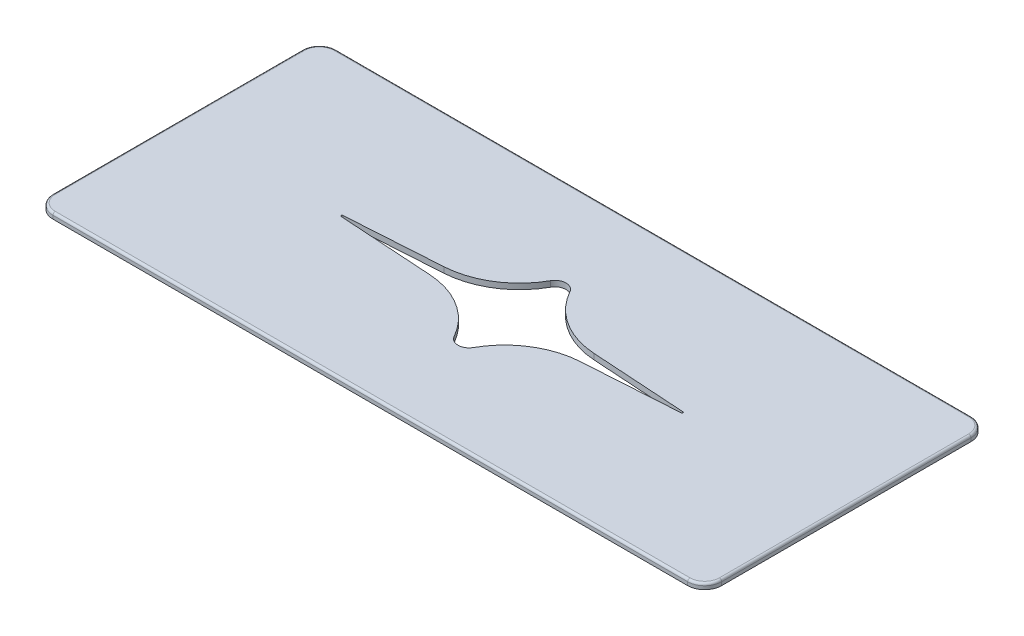
from build123d import *

# Parameters (mm, degrees)
SKETCH1_W           = 295
SKETCH1_H           = 125
BOSS_EXTRUDE1_DEPTH = 2.5
FILLET1_R           = 7.5
FILLET2_R           = 1
CUT_EXTRUDE4_DEPTH  = 10


with BuildPart() as part:
    # Sketch1 → Boss-Extrude1 (new body)
    with BuildSketch(Plane(origin=(0, 0, 0), x_dir=(1, 0, 0), z_dir=(0, 1, 0))):
        Rectangle(SKETCH1_W, SKETCH1_H)
    extrude(amount=BOSS_EXTRUDE1_DEPTH)

    # Fillet1
    fillet1_edges = [part.edges().sort_by_distance(p)[0] for p in [
        (147.5, 1.25, 62.5),
        (-147.5, 1.25, 62.5),
        (147.5, 1.25, -62.5),
        (-147.5, 1.25, -62.5),
    ]]
    fillet(fillet1_edges, radius=FILLET1_R)

    # Fillet2
    fillet2_edges = [part.edges().sort_by_distance(p)[0] for p in [
        (145.303300859, 2.5, -60.303300859),
        (147.5, 2.5, 0),
        (145.303300859, 2.5, 60.303300859),
        (0, 2.5, 62.5),
        (-145.303300859, 2.5, 60.303300859),
        (-147.5, 2.5, 0),
        (-145.303300859, 2.5, -60.303300859),
        (0, 2.5, -62.5),
    ]]
    fillet(fillet2_edges, radius=FILLET2_R)

    # Sketch4 → Cut-Extrude4 (cut)
    with BuildSketch(Plane(origin=(0, 2.5, 0), x_dir=(1, 0, 0), z_dir=(0, 1, 0))):
        with BuildLine():
            Line((-33.073998348, 3.090010623), (-75.025380216, 0.395089537))
            ThreePointArc((-75.025380216, 0.395089537), (-75.3959039, 0), (-75.025380216, -0.395089537))
            Line((-75.025380216, -0.395089537), (-33.073998348, -3.090010623))
            ThreePointArc((-33.073998348, -3.090010623), (-16.332033074, -8.52386445), (-4.236704547, -21.311483324))
            ThreePointArc((-4.236704547, -21.311483324), (0, -23.802100242), (4.236704547, -21.311483324))
            ThreePointArc((4.236704547, -21.311483324), (16.332033074, -8.52386445), (33.073998348, -3.090010623))
            Line((33.073998348, -3.090010623), (75.025380216, -0.395089537))
            ThreePointArc((75.025380216, -0.395089537), (75.3959039, 0), (75.025380216, 0.395089537))
            Line((75.025380216, 0.395089537), (33.073998348, 3.090010623))
            ThreePointArc((33.073998348, 3.090010623), (16.332033074, 8.52386445), (4.236704547, 21.311483324))
            ThreePointArc((4.236704547, 21.311483324), (0, 23.802100242), (-4.236704547, 21.311483324))
            ThreePointArc((-4.236704547, 21.311483324), (-16.332033074, 8.52386445), (-33.073998348, 3.090010623))
        make_face()
    extrude(amount=-CUT_EXTRUDE4_DEPTH, mode=Mode.SUBTRACT)


solid = part.part
